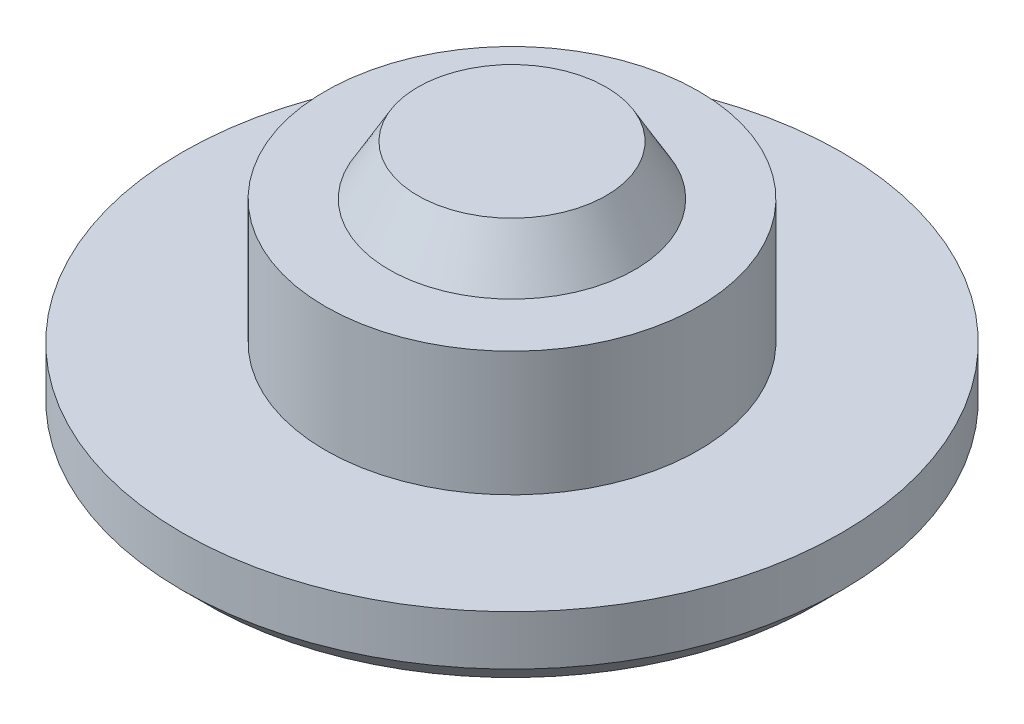
from build123d import *


with BuildPart() as part:
    # Sketch1 → body (revolve)
    with BuildSketch(Plane.XY):
        Polygon((0, 40), (15.131197846, 40), (19.75, 32), (30, 32), (30, 12), (53, 12), (53, 4), (49, 0), (0, 0), align=None)
    revolve(axis=Axis((0, 0, 0), (0, 1, 0)))


solid = part.part
